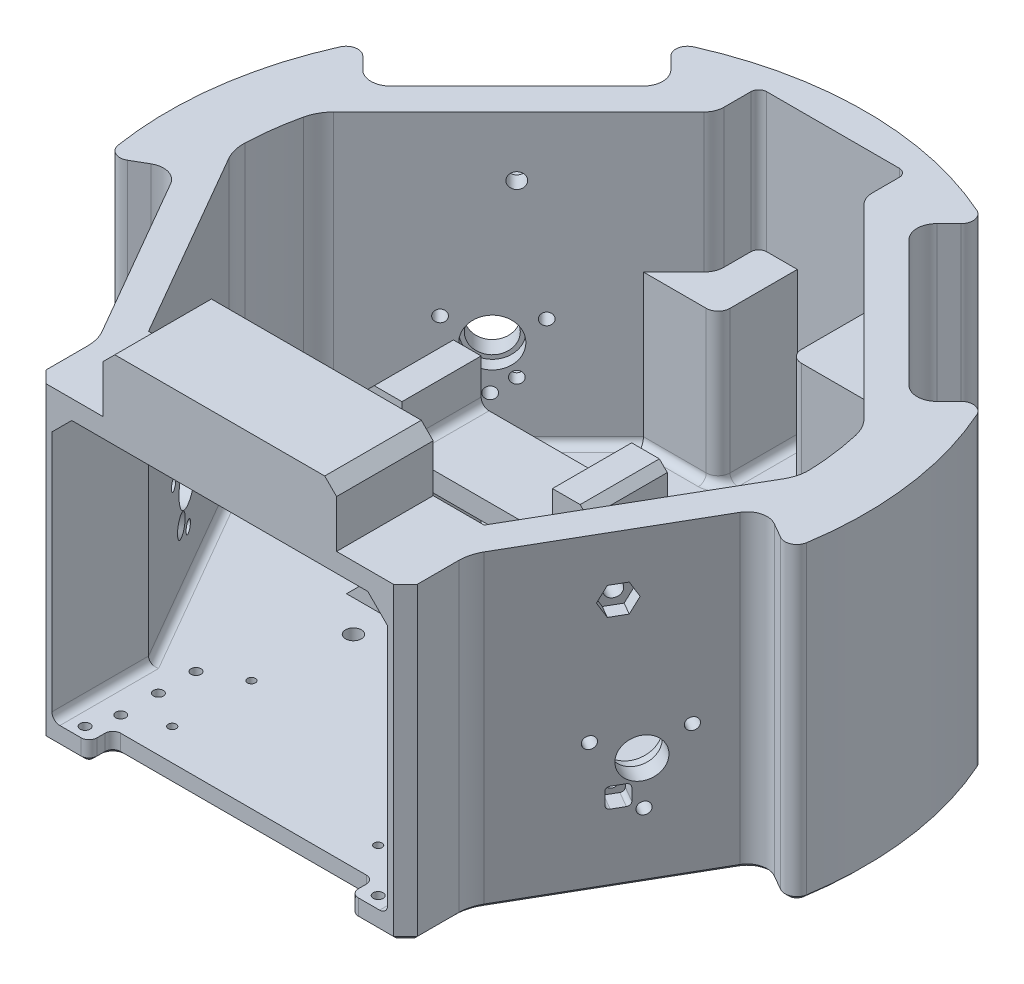
from build123d import *

# Parameters (mm, degrees)
BOSS_EXTRUDE1_DEPTH              = 5
BOSS_EXTRUDE2_DEPTH              = 73
SKETCH6_W                        = 84.74355653
SKETCH6_H                        = 24.390072762
BOSS_EXTRUDE4_DEPTH              = 4.8
FILLET1_R                        = 2
FILLET2_R                        = 5
FILLET3_R                        = 10
FILLET4_R                        = 3
CHAMFER1_SIZE                    = 5
SKETCH7_W                        = 5
SKETCH7_H                        = 5
CUT_EXTRUDE1_DEPTH               = 4.5
SKETCH10_R                       = 1
CUT_EXTRUDE2_DEPTH               = 2
HOLE1_START                      = 62
HOLE1_OUTLINE_R                  = 5
HOLE1_DEPTH                      = 8
HOLE1_2_OUTLINE_R                = 6
HOLE1_2_OUTLINE_R_2              = 5
HOLE1_2_DEPTH                    = 3.3
FILLET5_R                        = 1
F_3_0_START                      = 62
F_3_0_3_DIAMETER_HOLE1_OUTLINE_R = 1.5
F_3_0_3_DIAMETER_HOLE1_DEPTH     = 8
MIRROR2_START                    = -70
MIRROR2_OUTLINE_R                = 5
MIRROR2_OUTLINE_R_2              = 1.5
MIRROR2_DEPTH                    = 8
MIRROR2_START_2                  = -65.3
MIRROR2_2_OUTLINE_R              = 6
MIRROR2_2_OUTLINE_R_2            = 5
MIRROR2_2_DEPTH                  = 3.3
FILLET5_OF_MIRROR3_R             = 1
SKETCH19_W                       = 5
SKETCH19_H                       = 5
CUT_EXTRUDE3_DEPTH               = 4.5
SKETCH20_R                       = 1.5
CUT_EXTRUDE4_DEPTH               = 3.5
FILLET6_R                        = 1
HOLE2_START                      = -70
HOLE2_OUTLINE_R                  = 5
HOLE2_DEPTH                      = 8
HOLE2_START_2                    = -65.3
HOLE2_2_OUTLINE_R                = 6
HOLE2_2_OUTLINE_R_2              = 5
HOLE2_2_DEPTH                    = 3.3
F_3_0_3_DIAMETER_HOLE2_REACH     = 203.219
F_3_0_3_DIAMETER_HOLE2_BORE_R    = 1.5
FILLET6_OF_MIRROR8_R             = 1
SKETCH28_R                       = 1.5
CUT_EXTRUDE5_DEPTH               = 3.5
F_3_0_3_DIAMETER_HOLE3_REACH     = 203.219
F_3_0_3_DIAMETER_HOLE3_BORE_R    = 1.5
F_2_5MM_DOWEL_HOLE2_REACH        = 148.874
F_2_5MM_DOWEL_HOLE2_BORE_R       = 1.25
F_4_0_4_DIAMETER_HOLE1_D         = 4
F_2_0MM_DOWEL_HOLE1_REACH        = 148.874
F_2_0MM_DOWEL_HOLE1_BORE_R       = 1
FILLET9_R                        = 2
BOSS_EXTRUDE5_START              = 38
BOSS_EXTRUDE5_DEPTH              = 38
FILLET10_R                       = 3
SKETCH42_W                       = 9
SKETCH42_H                       = 20
BOSS_EXTRUDE6_DEPTH              = 33
SKETCH43_W                       = 56
SKETCH43_H                       = 20
BOSS_EXTRUDE7_DEPTH              = 5
SKETCH44_W                       = 9
SKETCH44_H                       = 20
BOSS_EXTRUDE8_DEPTH              = 11
FILLET11_R                       = 2
CHAMFER2_SIZE                    = 5
CHAMFER3_SIZE                    = 2
CUT_EXTRUDE6_DEPTH               = 3.5
M3_5_START                       = -66.5
M3_5_CLEARANCE_HOLE1_OUTLINE_R   = 1.95
M3_5_CLEARANCE_HOLE1_DEPTH       = 4.5
CUT_EXTRUDE7_DEPTH               = 3.5
M3_5_CLEARANCE_HOLE2_OUTLINE_R   = 1.95
M3_5_CLEARANCE_HOLE2_DEPTH       = 4.5
CHAMFER4_SIZE                    = 1
FILLET12_R                       = 2
SKETCH51_W                       = 59
SKETCH51_H                       = 24.390072762
BOSS_EXTRUDE9_DEPTH              = 15
CHAMFER5_SIZE                    = 3


# Read off the part's stored shape, not the designer's step: Hole1, Ø3.0 (3) Diameter Hole1, Mirror2, Hole2, M3.5 Clearance Hole1, M3.5 Clearance Hole2
with BuildPart() as part:
    # Sketch2 → Boss-Extrude1 (new body)
    with BuildSketch(Plane(origin=(0, 0, 0), x_dir=(1, 0, 0), z_dir=(0, 1, 0))):
        with BuildLine():
            Line((30.0520382, 68.942911166), (68.942911166, 30.0520382))
            Line((68.942911166, 30.0520382), (78.554445948, 39.663572983))
            ThreePointArc((78.554445948, 39.663572983), (87.247147801, 11.486304915), (86.143456196, -17.980682818))
            Line((86.143456196, -17.980682818), (74.371778265, -11.184301396))
            Line((74.371778265, -11.184301396), (46.871778265, -58.815698604))
            Line((46.871778265, -58.815698604), (46.871778265, -72))
            Line((46.871778265, -72), (43.871778265, -75))
            Line((43.871778265, -75), (33, -75))
            Line((33, -75), (33, -69))
            Line((33, -69), (-33, -69))
            Line((-33, -69), (-33, -75))
            Line((-33, -75), (-43.871778265, -75))
            Line((-43.871778265, -75), (-46.871778265, -72))
            Line((-46.871778265, -72), (-46.871778265, -58.815698604))
            Line((-46.871778265, -58.815698604), (-74.371778265, -11.184301396))
            Line((-74.371778265, -11.184301396), (-86.143456196, -17.980682818))
            ThreePointArc((-86.143456196, -17.980682818), (-87.247147801, 11.486304915), (-78.554445948, 39.663572983))
            Line((-78.554445948, 39.663572983), (-68.942911166, 30.0520382))
            Line((-68.942911166, 30.0520382), (-30.0520382, 68.942911166))
            Line((-30.0520382, 68.942911166), (-39.663572983, 78.554445948))
            ThreePointArc((-39.663572983, 78.554445948), (0, 88), (39.663572983, 78.554445948))
            Line((39.663572983, 78.554445948), (30.0520382, 68.942911166))
        make_face()
    extrude(amount=BOSS_EXTRUDE1_DEPTH)

    # Sketch4 → Boss-Extrude2 (add)
    with BuildSketch(Plane(origin=(0, 5, 0), x_dir=(1, 0, 0), z_dir=(0, 1, 0))):
        with BuildLine():
            Line((-68.942911166, 18.738329701), (-18.738329701, 68.942911166))
            Line((-18.738329701, 68.942911166), (-18.738329701, 79.830288738))
            Line((-18.738329701, 79.830288738), (18.738329701, 79.830288738))
            Line((18.738329701, 79.830288738), (18.738329701, 68.942911166))
            Line((18.738329701, 68.942911166), (68.942911166, 18.738329701))
            ThreePointArc((68.942911166, 18.738329701), (70.832820425, 9.32531772), (71.443575035, -0.256098166))
            Line((71.443575035, -0.256098166), (42.371778265, -50.609927238))
            Line((42.371778265, -50.609927238), (42.371778265, -75))
            Line((42.371778265, -75), (43.871778265, -75))
            Line((43.871778265, -75), (46.871778265, -72))
            Line((46.871778265, -72), (46.871778265, -58.815698604))
            Line((46.871778265, -58.815698604), (74.371778265, -11.184301396))
            Line((74.371778265, -11.184301396), (86.143456196, -17.980682818))
            ThreePointArc((86.143456196, -17.980682818), (87.247147801, 11.486304915), (78.554445948, 39.663572983))
            Line((78.554445948, 39.663572983), (68.942911166, 30.0520382))
            Line((68.942911166, 30.0520382), (30.0520382, 68.942911166))
            Line((30.0520382, 68.942911166), (39.663572983, 78.554445948))
            ThreePointArc((39.663572983, 78.554445948), (0, 88), (-39.663572983, 78.554445948))
            Line((-39.663572983, 78.554445948), (-30.0520382, 68.942911166))
            Line((-30.0520382, 68.942911166), (-68.942911166, 30.0520382))
            Line((-68.942911166, 30.0520382), (-78.554445948, 39.663572983))
            ThreePointArc((-78.554445948, 39.663572983), (-87.247147801, 11.486304915), (-86.143456196, -17.980682818))
            Line((-86.143456196, -17.980682818), (-74.371778265, -11.184301396))
            Line((-74.371778265, -11.184301396), (-46.871778265, -58.815698604))
            Line((-46.871778265, -58.815698604), (-46.871778265, -72))
            Line((-46.871778265, -72), (-43.871778265, -75))
            Line((-43.871778265, -75), (-42.371778265, -75))
            Line((-42.371778265, -75), (-42.371778265, -50.609927238))
            Line((-42.371778265, -50.609927238), (-71.443575035, -0.256098166))
            ThreePointArc((-71.443575035, -0.256098166), (-70.832820425, 9.32531772), (-68.942911166, 18.738329701))
        make_face()
    extrude(amount=BOSS_EXTRUDE2_DEPTH)

    # Sketch6 → Boss-Extrude4 (add)
    with BuildSketch(Plane(origin=(0, 78, 0), x_dir=(1, 0, 0), z_dir=(0, 1, 0))):
        with Locations((0, -62.804963619)):
            Rectangle(SKETCH6_W, SKETCH6_H)
    extrude(amount=-BOSS_EXTRUDE4_DEPTH)

    # Fillet1
    fillet1_edges = [part.edges().sort_by_distance(p)[0] for p in [
        (33, 2.5, 75),
        (33, 2.5, 69),
        (-33, 2.5, 69),
        (-33, 2.5, 75),
    ]]
    fillet(fillet1_edges, radius=FILLET1_R)

    # Fillet2
    fillet2_edges = [part.edges().sort_by_distance(p)[0] for p in [
        (30.0520382, 39, -68.942911166),
        (68.942911166, 39, -30.0520382),
        (74.371778265, 39, 11.184301396),
        (-74.371778265, 39, 11.184301396),
        (-68.942911166, 39, -30.0520382),
        (-30.0520382, 39, -68.942911166),
        (18.738329701, 41.5, -68.942911166),
        (-18.738329701, 41.5, -68.942911166),
    ]]
    fillet(fillet2_edges, radius=FILLET2_R)

    # Fillet3
    fillet3_edges = [part.edges().sort_by_distance(p)[0] for p in [
        (46.871778265, 39, 58.815698604),
        (-46.871778265, 39, 58.815698604),
        (68.942911166, 41.5, -18.738329701),
        (71.443575035, 41.5, 0.256098166),
        (-71.443575035, 41.5, 0.256098166),
        (-68.942911166, 41.5, -18.738329701),
    ]]
    fillet(fillet3_edges, radius=FILLET3_R)

    # Fillet4
    fillet4_edges = [part.edges().sort_by_distance(p)[0] for p in [
        (39.663572983, 39, -78.554445948),
        (78.554445948, 39, -39.663572983),
        (86.143456196, 39, 17.980682818),
        (-86.143456196, 39, 17.980682818),
        (-78.554445948, 39, -39.663572983),
        (-39.663572983, 39, -78.554445948),
    ]]
    fillet(fillet4_edges, radius=FILLET4_R)

    # Chamfer1
    chamfer1_edges = [part.edges().sort_by_distance(p)[0] for p in [
        (-42.371778265, 73.2, 62.804963619),
        (42.371778265, 73.2, 62.804963619),
    ]]
    chamfer(chamfer1_edges, length=CHAMFER1_SIZE)

    # Sketch7 → Cut-Extrude1 (cut)
    with BuildSketch(Plane(origin=(60.621778265, 0, 35), x_dir=(0.49999999999999983, 0, -0.8660254037844387), z_dir=(0.8660254037844387, 0, 0.49999999999999983))):
        with Locations((0, 20)):
            Rectangle(SKETCH7_W, SKETCH7_H)
    cut_extrude1 = extrude(amount=-CUT_EXTRUDE1_DEPTH, mode=Mode.SUBTRACT)

    # Sketch10 → Cut-Extrude2 (cut)
    with BuildSketch(Plane(origin=(56.724663948, 0, 32.75), x_dir=(0.4999999999999997, 0, -0.8660254037844388), z_dir=(0.8660254037844389, 0, 0.49999999999999983))):
        with Locations((0, 20)):
            Circle(SKETCH10_R)
    cut_extrude2 = extrude(amount=-CUT_EXTRUDE2_DEPTH, mode=Mode.SUBTRACT)

    # Sketch9 → CSK for M3 SFHCS1 (revolve, cut)
    with BuildSketch(Plane(origin=(53.693575035, 20, 31), x_dir=(-0.5000000000000001, 0, 0.8660254037844386), z_dir=(0, 1, 0))):
        Polygon((0, 0), (0, 8.750075774), (1.25, 7.999), (1.25, 1.4), (2.65, 0), align=None)
    revolve(axis=Axis((48.194313721, 20, 27.825), (0.8660254037844387, 0, 0.5000000000000001)), mode=Mode.SUBTRACT)

    # Hole1 outline → Hole1 (cut)
    with BuildSketch(Plane(origin=(0, 0, 0), x_dir=(0.5000000000000003, 0, -0.8660254037844385), z_dir=(0.8660254037844385, 0, 0.5000000000000003)).offset(HOLE1_START)):
        with Locations((4.375, 27.577722283)):
            Circle(HOLE1_OUTLINE_R)
    extrude(amount=HOLE1_DEPTH, mode=Mode.SUBTRACT)

    # Hole1 2 outline → Hole1 2 (cut)
    with BuildSketch(Plane(origin=(0, 0, 0), x_dir=(0.5000000000000003, 0, -0.8660254037844385), z_dir=(0.8660254037844385, 0, 0.5000000000000003)).offset(HOLE1_START)):
        with Locations((4.375, 27.577722283)):
            Circle(HOLE1_2_OUTLINE_R)
        with Locations((4.375, 27.577722283)):
            Circle(HOLE1_2_OUTLINE_R_2, mode=Mode.SUBTRACT)
    extrude(amount=HOLE1_2_DEPTH, mode=Mode.SUBTRACT)

    # Fillet5
    fillet5_edges = [part.edges().sort_by_distance(p)[0] for p in [
        (59.923221106, 22.5, 31.709936491),
        (59.923221106, 17.5, 31.709936491),
        (57.423221106, 17.5, 36.040063509),
        (57.423221106, 22.5, 36.040063509),
    ]]
    fillet(fillet5_edges, radius=FILLET5_R)

    # Ø3.0 (3) Diameter Hole1 outline → Ø3.0 (3) Diameter Hole1 (cut)
    with BuildSketch(Plane(origin=(0, 0, 0), x_dir=(0.49999999999999956, 0, -0.8660254037844389), z_dir=(0.8660254037844388, 0, 0.4999999999999999)).offset(F_3_0_START)):
        with Locations((4.758894464, 16.584423186)):
            Circle(F_3_0_3_DIAMETER_HOLE1_OUTLINE_R)
        with Locations((-5.337423521, 32.741909474)):
            Circle(F_3_0_3_DIAMETER_HOLE1_OUTLINE_R)
        with Locations((13.703529058, 33.40683419)):
            Circle(F_3_0_3_DIAMETER_HOLE1_OUTLINE_R)
    extrude(amount=F_3_0_3_DIAMETER_HOLE1_DEPTH, mode=Mode.SUBTRACT)

    # Mirror2 outline → Mirror2 (cut)
    with BuildSketch(Plane(origin=(0, 0, 0), x_dir=(0.5000000000000003, 0, 0.8660254037844385), z_dir=(0.8660254037844385, 0, -0.5000000000000003)).offset(MIRROR2_START)):
        with Locations((-4.375, -27.577722283)):
            Circle(MIRROR2_OUTLINE_R)
        with Locations((-13.703529058, -33.40683419)):
            Circle(MIRROR2_OUTLINE_R_2)
        with Locations((-4.758894464, -16.584423186)):
            Circle(MIRROR2_OUTLINE_R_2)
        with Locations((5.337423521, -32.741909474)):
            Circle(MIRROR2_OUTLINE_R_2)
    extrude(amount=MIRROR2_DEPTH, mode=Mode.SUBTRACT)

    # Mirror2 2 outline → Mirror2 2 (cut)
    with BuildSketch(Plane(origin=(0, 0, 0), x_dir=(0.5000000000000003, 0, 0.8660254037844385), z_dir=(0.8660254037844385, 0, -0.5000000000000003)).offset(MIRROR2_START_2)):
        with Locations((-4.375, -27.577722283)):
            Circle(MIRROR2_2_OUTLINE_R)
        with Locations((-4.375, -27.577722283)):
            Circle(MIRROR2_2_OUTLINE_R_2, mode=Mode.SUBTRACT)
    extrude(amount=MIRROR2_2_DEPTH, mode=Mode.SUBTRACT)

    # Mirror2 3 outline → Mirror2 3 (revolve, cut)
    with BuildSketch(Plane(origin=(0, 20, 0), x_dir=(0.5000000000000003, 0, 0.8660254037844385), z_dir=(0, 1, 0))):
        Polygon((0, -62), (0, -65.5), (1.25, -65.5), (1.25, -63.4), (2.65, -62), align=None)
    revolve(axis=Axis((0, 20, 0), (0.8660254037844385, 0, -0.5000000000000003)), mode=Mode.SUBTRACT)

    # Mirror3: Cut-Extrude1, Cut-Extrude2 across plane
    add(cut_extrude1.mirror(Plane(origin=(0, 0, 0), x_dir=(0, 0, 1), z_dir=(1, 0, 0))), mode=Mode.SUBTRACT)
    add(cut_extrude2.mirror(Plane(origin=(0, 0, 0), x_dir=(0, 0, 1), z_dir=(1, 0, 0))), mode=Mode.SUBTRACT)

    # Fillet5 of Mirror3
    fillet5_of_mirror3_edges = [part.edges().sort_by_distance(p)[0] for p in [
        (-59.923221106, 22.5, 31.709936491),
        (-59.923221106, 17.5, 31.709936491),
        (-57.423221106, 17.5, 36.040063509),
        (-57.423221106, 22.5, 36.040063509),
    ]]
    fillet(fillet5_of_mirror3_edges, radius=FILLET5_OF_MIRROR3_R)

    # Sketch19 → Cut-Extrude3 (cut)
    with BuildSketch(Plane(origin=(-49.497474683, 0, -49.497474683), x_dir=(-0.7071067811865475, 0, 0.7071067811865477), z_dir=(-0.7071067811865477, 0, -0.7071067811865475))):
        with Locations((0, 20)):
            Rectangle(SKETCH19_W, SKETCH19_H)
    cut_extrude3 = extrude(amount=-CUT_EXTRUDE3_DEPTH, mode=Mode.SUBTRACT)

    # Sketch20 → Cut-Extrude4 (cut)
    with BuildSketch(Plane(origin=(-46.315494168, 0, -46.315494168), x_dir=(-0.7071067811865475, 0, 0.7071067811865477), z_dir=(-0.7071067811865477, 0, -0.7071067811865475))):
        with Locations((0, 20)):
            Circle(SKETCH20_R)
    extrude(amount=-CUT_EXTRUDE4_DEPTH, mode=Mode.SUBTRACT)

    # Fillet6
    fillet6_edges = [part.edges().sort_by_distance(p)[0] for p in [
        (-49.674251378, 22.5, -46.138717472),
        (-49.674251378, 17.5, -46.138717472),
        (-46.138717472, 17.5, -49.674251378),
        (-46.138717472, 22.5, -49.674251378),
    ]]
    fillet(fillet6_edges, radius=FILLET6_R)

    # Hole2 outline → Hole2 (cut)
    with BuildSketch(Plane(origin=(0, 0, 0), x_dir=(0.7071067811865471, 0, -0.707106781186548), z_dir=(0.707106781186548, 0, 0.707106781186547)).offset(HOLE2_START)):
        with Locations((-4.375, 27.577722283)):
            Circle(HOLE2_OUTLINE_R)
    hole2 = extrude(amount=HOLE2_DEPTH, mode=Mode.SUBTRACT)

    # Hole2 2 outline → Hole2 2 (cut)
    with BuildSketch(Plane(origin=(0, 0, 0), x_dir=(0.7071067811865471, 0, -0.707106781186548), z_dir=(0.707106781186548, 0, 0.707106781186547)).offset(HOLE2_START_2)):
        with Locations((-4.375, 27.577722283)):
            Circle(HOLE2_2_OUTLINE_R)
        with Locations((-4.375, 27.577722283)):
            Circle(HOLE2_2_OUTLINE_R_2, mode=Mode.SUBTRACT)
    hole2_2 = extrude(amount=HOLE2_2_DEPTH, mode=Mode.SUBTRACT)

    # Ø3.0 (3) Diameter Hole2 bore → Ø3.0 (3) Diameter Hole2 (cut, up to next)
    with BuildSketch(Plane(origin=(-49.497474683, 0, -49.497474683), x_dir=(-0.7071067811865475, 0, 0.7071067811865477), z_dir=(-0.7071067811865477, 0, -0.7071067811865475)), mode=Mode.PRIVATE) as f_3_0_3_diameter_hole2_sk1:
        with Locations((13.703529058, 33.40683419)):
            Circle(F_3_0_3_DIAMETER_HOLE2_BORE_R)
    f_3_0_3_diameter_hole2_tool1 = extrude(f_3_0_3_diameter_hole2_sk1.sketch, amount=-F_3_0_3_DIAMETER_HOLE2_REACH, mode=Mode.PRIVATE) & part.part
    # Ø3.0 (3) Diameter Hole2 bore → Ø3.0 (3) Diameter Hole2 (cut, up to next)
    with BuildSketch(Plane(origin=(-49.497474683, 0, -49.497474683), x_dir=(-0.7071067811865475, 0, 0.7071067811865477), z_dir=(-0.7071067811865477, 0, -0.7071067811865475)), mode=Mode.PRIVATE) as f_3_0_3_diameter_hole2_sk2:
        with Locations((-5.337423521, 32.741909474)):
            Circle(F_3_0_3_DIAMETER_HOLE2_BORE_R)
    f_3_0_3_diameter_hole2_tool2 = extrude(f_3_0_3_diameter_hole2_sk2.sketch, amount=-F_3_0_3_DIAMETER_HOLE2_REACH, mode=Mode.PRIVATE) & part.part
    # Ø3.0 (3) Diameter Hole2 bore → Ø3.0 (3) Diameter Hole2 (cut, up to next)
    with BuildSketch(Plane(origin=(-49.497474683, 0, -49.497474683), x_dir=(-0.7071067811865475, 0, 0.7071067811865477), z_dir=(-0.7071067811865477, 0, -0.7071067811865475)), mode=Mode.PRIVATE) as f_3_0_3_diameter_hole2_sk3:
        with Locations((4.758894464, 16.584423186)):
            Circle(F_3_0_3_DIAMETER_HOLE2_BORE_R)
    f_3_0_3_diameter_hole2_tool3 = extrude(f_3_0_3_diameter_hole2_sk3.sketch, amount=-F_3_0_3_DIAMETER_HOLE2_REACH, mode=Mode.PRIVATE) & part.part
    add(f_3_0_3_diameter_hole2_tool1.solids().sort_by_distance((-59.187333, 33.406834, -39.807616))[0], mode=Mode.SUBTRACT)
    add(f_3_0_3_diameter_hole2_tool2.solids().sort_by_distance((-45.723346, 32.741909, -53.271603))[0], mode=Mode.SUBTRACT)
    add(f_3_0_3_diameter_hole2_tool3.solids().sort_by_distance((-52.862521, 16.584423, -46.132428))[0], mode=Mode.SUBTRACT)

    # Mirror6: Hole2, Hole2 2 across plane
    add(hole2.mirror(Plane(origin=(0, 0, 0), x_dir=(0, 0, 1), z_dir=(1, 0, 0))), mode=Mode.SUBTRACT)
    add(hole2_2.mirror(Plane(origin=(0, 0, 0), x_dir=(0, 0, 1), z_dir=(1, 0, 0))), mode=Mode.SUBTRACT)

    # Mirror8: Cut-Extrude3 across plane
    add(cut_extrude3.mirror(Plane(origin=(0, 0, 0), x_dir=(0, 0, 1), z_dir=(1, 0, 0))), mode=Mode.SUBTRACT)

    # Fillet6 of Mirror8
    fillet6_of_mirror8_edges = [part.edges().sort_by_distance(p)[0] for p in [
        (49.674251378, 22.5, -46.138717472),
        (49.674251378, 17.5, -46.138717472),
        (46.138717472, 17.5, -49.674251378),
        (46.138717472, 22.5, -49.674251378),
    ]]
    fillet(fillet6_of_mirror8_edges, radius=FILLET6_OF_MIRROR8_R)

    # Sketch28 → Cut-Extrude5 (cut)
    with BuildSketch(Plane(origin=(46.315494168, 0, -46.315494168), x_dir=(-0.7071067811865475, 0, -0.7071067811865477), z_dir=(0.7071067811865477, 0, -0.7071067811865475))):
        with Locations((0, 20)):
            Circle(SKETCH28_R)
    extrude(amount=-CUT_EXTRUDE5_DEPTH, mode=Mode.SUBTRACT)

    # Ø3.0 (3) Diameter Hole3 bore → Ø3.0 (3) Diameter Hole3 (cut, up to next)
    with BuildSketch(Plane(origin=(49.497474683, 0, -49.497474683), x_dir=(-0.7071067811865476, 0, -0.7071067811865476), z_dir=(0.7071067811865476, 0, -0.7071067811865476)), mode=Mode.PRIVATE) as f_3_0_3_diameter_hole3_sk1:
        with Locations((1.9343408, 36.58839477)):
            Circle(F_3_0_3_DIAMETER_HOLE3_BORE_R)
    f_3_0_3_diameter_hole3_tool1 = extrude(f_3_0_3_diameter_hole3_sk1.sketch, amount=-F_3_0_3_DIAMETER_HOLE3_REACH, mode=Mode.PRIVATE) & part.part
    # Ø3.0 (3) Diameter Hole3 bore → Ø3.0 (3) Diameter Hole3 (cut, up to next)
    with BuildSketch(Plane(origin=(49.497474683, 0, -49.497474683), x_dir=(-0.7071067811865476, 0, -0.7071067811865476), z_dir=(0.7071067811865476, 0, -0.7071067811865476)), mode=Mode.PRIVATE) as f_3_0_3_diameter_hole3_sk2:
        with Locations((-15.333141679, 28.536435453)):
            Circle(F_3_0_3_DIAMETER_HOLE3_BORE_R)
    f_3_0_3_diameter_hole3_tool2 = extrude(f_3_0_3_diameter_hole3_sk2.sketch, amount=-F_3_0_3_DIAMETER_HOLE3_REACH, mode=Mode.PRIVATE) & part.part
    add(f_3_0_3_diameter_hole3_tool1.solids().sort_by_distance((48.129689, 36.588395, -50.86526))[0], mode=Mode.SUBTRACT)
    add(f_3_0_3_diameter_hole3_tool2.solids().sort_by_distance((60.339643, 28.536435, -38.655306))[0], mode=Mode.SUBTRACT)

    # Ø2.5mm Dowel Hole2 bore → Ø2.5mm Dowel Hole2 (cut, up to next)
    with BuildSketch(Plane(origin=(0, 0, 0), x_dir=(-1, 0, 0), z_dir=(0, -1, 0)), mode=Mode.PRIVATE) as f_2_5mm_dowel_hole2_sk1:
        with Locations((35, -65)):
            Circle(F_2_5MM_DOWEL_HOLE2_BORE_R)
    f_2_5mm_dowel_hole2_tool1 = extrude(f_2_5mm_dowel_hole2_sk1.sketch, amount=-F_2_5MM_DOWEL_HOLE2_REACH, mode=Mode.PRIVATE) & part.part
    # Ø2.5mm Dowel Hole2 bore → Ø2.5mm Dowel Hole2 (cut, up to next)
    with BuildSketch(Plane(origin=(0, 0, 0), x_dir=(-1, 0, 0), z_dir=(0, -1, 0)), mode=Mode.PRIVATE) as f_2_5mm_dowel_hole2_sk2:
        with Locations((35, -46)):
            Circle(F_2_5MM_DOWEL_HOLE2_BORE_R)
    f_2_5mm_dowel_hole2_tool2 = extrude(f_2_5mm_dowel_hole2_sk2.sketch, amount=-F_2_5MM_DOWEL_HOLE2_REACH, mode=Mode.PRIVATE) & part.part
    # Ø2.5mm Dowel Hole2 bore → Ø2.5mm Dowel Hole2 (cut, up to next)
    with BuildSketch(Plane(origin=(0, 0, 0), x_dir=(-1, 0, 0), z_dir=(0, -1, 0)), mode=Mode.PRIVATE) as f_2_5mm_dowel_hole2_sk3:
        with Locations((-35, -65)):
            Circle(F_2_5MM_DOWEL_HOLE2_BORE_R)
    f_2_5mm_dowel_hole2_tool3 = extrude(f_2_5mm_dowel_hole2_sk3.sketch, amount=-F_2_5MM_DOWEL_HOLE2_REACH, mode=Mode.PRIVATE) & part.part
    # Ø2.5mm Dowel Hole2 bore → Ø2.5mm Dowel Hole2 (cut, up to next)
    with BuildSketch(Plane(origin=(0, 0, 0), x_dir=(-1, 0, 0), z_dir=(0, -1, 0)), mode=Mode.PRIVATE) as f_2_5mm_dowel_hole2_sk4:
        with Locations((-35, -46)):
            Circle(F_2_5MM_DOWEL_HOLE2_BORE_R)
    f_2_5mm_dowel_hole2_tool4 = extrude(f_2_5mm_dowel_hole2_sk4.sketch, amount=-F_2_5MM_DOWEL_HOLE2_REACH, mode=Mode.PRIVATE) & part.part
    # Ø2.5mm Dowel Hole2 bore → Ø2.5mm Dowel Hole2 (cut, up to next)
    with BuildSketch(Plane(origin=(0, 0, 0), x_dir=(-1, 0, 0), z_dir=(0, -1, 0)), mode=Mode.PRIVATE) as f_2_5mm_dowel_hole2_sk5:
        with Locations((-37, -72)):
            Circle(F_2_5MM_DOWEL_HOLE2_BORE_R)
    f_2_5mm_dowel_hole2_tool5 = extrude(f_2_5mm_dowel_hole2_sk5.sketch, amount=-F_2_5MM_DOWEL_HOLE2_REACH, mode=Mode.PRIVATE) & part.part
    # Ø2.5mm Dowel Hole2 bore → Ø2.5mm Dowel Hole2 (cut, up to next)
    with BuildSketch(Plane(origin=(0, 0, 0), x_dir=(-1, 0, 0), z_dir=(0, -1, 0)), mode=Mode.PRIVATE) as f_2_5mm_dowel_hole2_sk6:
        with Locations((37, -72)):
            Circle(F_2_5MM_DOWEL_HOLE2_BORE_R)
    f_2_5mm_dowel_hole2_tool6 = extrude(f_2_5mm_dowel_hole2_sk6.sketch, amount=-F_2_5MM_DOWEL_HOLE2_REACH, mode=Mode.PRIVATE) & part.part
    # Ø2.5mm Dowel Hole2 bore → Ø2.5mm Dowel Hole2 (cut, up to next)
    with BuildSketch(Plane(origin=(0, 0, 0), x_dir=(-1, 0, 0), z_dir=(0, -1, 0)), mode=Mode.PRIVATE) as f_2_5mm_dowel_hole2_sk7:
        with Locations((35, -55.5)):
            Circle(F_2_5MM_DOWEL_HOLE2_BORE_R)
    f_2_5mm_dowel_hole2_tool7 = extrude(f_2_5mm_dowel_hole2_sk7.sketch, amount=-F_2_5MM_DOWEL_HOLE2_REACH, mode=Mode.PRIVATE) & part.part
    # Ø2.5mm Dowel Hole2 bore → Ø2.5mm Dowel Hole2 (cut, up to next)
    with BuildSketch(Plane(origin=(0, 0, 0), x_dir=(-1, 0, 0), z_dir=(0, -1, 0)), mode=Mode.PRIVATE) as f_2_5mm_dowel_hole2_sk8:
        with Locations((-35, -55.5)):
            Circle(F_2_5MM_DOWEL_HOLE2_BORE_R)
    f_2_5mm_dowel_hole2_tool8 = extrude(f_2_5mm_dowel_hole2_sk8.sketch, amount=-F_2_5MM_DOWEL_HOLE2_REACH, mode=Mode.PRIVATE) & part.part
    add(f_2_5mm_dowel_hole2_tool1.solids().sort_by_distance((-35, 0, 65))[0], mode=Mode.SUBTRACT)
    add(f_2_5mm_dowel_hole2_tool2.solids().sort_by_distance((-35, 0, 46))[0], mode=Mode.SUBTRACT)
    add(f_2_5mm_dowel_hole2_tool3.solids().sort_by_distance((35, 0, 65))[0], mode=Mode.SUBTRACT)
    add(f_2_5mm_dowel_hole2_tool4.solids().sort_by_distance((35, 0, 46))[0], mode=Mode.SUBTRACT)
    add(f_2_5mm_dowel_hole2_tool5.solids().sort_by_distance((37, 0, 72))[0], mode=Mode.SUBTRACT)
    add(f_2_5mm_dowel_hole2_tool6.solids().sort_by_distance((-37, 0, 72))[0], mode=Mode.SUBTRACT)
    add(f_2_5mm_dowel_hole2_tool7.solids().sort_by_distance((-35, 0, 55.5))[0], mode=Mode.SUBTRACT)
    add(f_2_5mm_dowel_hole2_tool8.solids().sort_by_distance((35, 0, 55.5))[0], mode=Mode.SUBTRACT)

    # Ø4.0 (4) Diameter Hole1 (through all)
    with Locations(Plane(origin=(0, 0, 0), x_dir=(-1, 0, 0), z_dir=(0, -1, 0))):
        with Locations((5, 38), (-5, 38), (23.25, -18), (-23.25, -18)):
            Hole(F_4_0_4_DIAMETER_HOLE1_D / 2)

    # Ø2.0mm Dowel Hole1 bore → Ø2.0mm Dowel Hole1 (cut, up to next)
    with BuildSketch(Plane(origin=(0, 0, 0), x_dir=(-1, 0, 0), z_dir=(0, -1, 0)), mode=Mode.PRIVATE) as f_2_0mm_dowel_hole1_sk1:
        with Locations((26, -61)):
            Circle(F_2_0MM_DOWEL_HOLE1_BORE_R)
    f_2_0mm_dowel_hole1_tool1 = extrude(f_2_0mm_dowel_hole1_sk1.sketch, amount=-F_2_0MM_DOWEL_HOLE1_REACH, mode=Mode.PRIVATE) & part.part
    # Ø2.0mm Dowel Hole1 bore → Ø2.0mm Dowel Hole1 (cut, up to next)
    with BuildSketch(Plane(origin=(0, 0, 0), x_dir=(-1, 0, 0), z_dir=(0, -1, 0)), mode=Mode.PRIVATE) as f_2_0mm_dowel_hole1_sk2:
        with Locations((26, -41)):
            Circle(F_2_0MM_DOWEL_HOLE1_BORE_R)
    f_2_0mm_dowel_hole1_tool2 = extrude(f_2_0mm_dowel_hole1_sk2.sketch, amount=-F_2_0MM_DOWEL_HOLE1_REACH, mode=Mode.PRIVATE) & part.part
    # Ø2.0mm Dowel Hole1 bore → Ø2.0mm Dowel Hole1 (cut, up to next)
    with BuildSketch(Plane(origin=(0, 0, 0), x_dir=(-1, 0, 0), z_dir=(0, -1, 0)), mode=Mode.PRIVATE) as f_2_0mm_dowel_hole1_sk3:
        with Locations((-26, -41)):
            Circle(F_2_0MM_DOWEL_HOLE1_BORE_R)
    f_2_0mm_dowel_hole1_tool3 = extrude(f_2_0mm_dowel_hole1_sk3.sketch, amount=-F_2_0MM_DOWEL_HOLE1_REACH, mode=Mode.PRIVATE) & part.part
    # Ø2.0mm Dowel Hole1 bore → Ø2.0mm Dowel Hole1 (cut, up to next)
    with BuildSketch(Plane(origin=(0, 0, 0), x_dir=(-1, 0, 0), z_dir=(0, -1, 0)), mode=Mode.PRIVATE) as f_2_0mm_dowel_hole1_sk4:
        with Locations((-26, -61)):
            Circle(F_2_0MM_DOWEL_HOLE1_BORE_R)
    f_2_0mm_dowel_hole1_tool4 = extrude(f_2_0mm_dowel_hole1_sk4.sketch, amount=-F_2_0MM_DOWEL_HOLE1_REACH, mode=Mode.PRIVATE) & part.part
    add(f_2_0mm_dowel_hole1_tool1.solids().sort_by_distance((-26, 0, 61))[0], mode=Mode.SUBTRACT)
    add(f_2_0mm_dowel_hole1_tool2.solids().sort_by_distance((-26, 0, 41))[0], mode=Mode.SUBTRACT)
    add(f_2_0mm_dowel_hole1_tool3.solids().sort_by_distance((26, 0, 41))[0], mode=Mode.SUBTRACT)
    add(f_2_0mm_dowel_hole1_tool4.solids().sort_by_distance((26, 0, 61))[0], mode=Mode.SUBTRACT)

    # Fillet9
    fillet9_edges = [part.edges().sort_by_distance(p)[0] for p in [
        (-18.738329701, 41.5, -79.830288738),
        (18.738329701, 41.5, -79.830288738),
    ]]
    fillet(fillet9_edges, radius=FILLET9_R)

    # Sketch41 → Boss-Extrude5 (add)
    with BuildSketch(Plane(origin=(0, 5, 0), x_dir=(1, 0, 0), z_dir=(0, 1, 0)).offset(BOSS_EXTRUDE5_START)):
        with BuildLine():
            Line((-16.738329701, 79.830288738), (-9, 79.830288738))
            Line((-9, 79.830288738), (-9, 59.830288738))
            Line((-9, 59.830288738), (-27.850952129, 59.830288738))
            Line((-27.850952129, 59.830288738), (-20.202795796, 67.478445072))
            ThreePointArc((-20.202795796, 67.478445072), (-19.118932039, 69.100561816), (-18.738329701, 71.013978978))
            Line((-18.738329701, 71.013978978), (-18.738329701, 77.830288738))
            ThreePointArc((-18.738329701, 77.830288738), (-18.152543264, 79.2445023), (-16.738329701, 79.830288738))
        make_face()
        with BuildLine():
            Line((18.738329701, 71.013978978), (18.738329701, 77.830288738))
            ThreePointArc((18.738329701, 77.830288738), (18.152543264, 79.2445023), (16.738329701, 79.830288738))
            Line((16.738329701, 79.830288738), (9, 79.830288738))
            Line((9, 79.830288738), (9, 59.830288738))
            Line((9, 59.830288738), (27.850952129, 59.830288738))
            Line((27.850952129, 59.830288738), (20.202795796, 67.478445072))
            ThreePointArc((20.202795796, 67.478445072), (19.118932039, 69.100561816), (18.738329701, 71.013978978))
        make_face()
    extrude(amount=-BOSS_EXTRUDE5_DEPTH)

    # Fillet10
    fillet10_edges = [part.edges().sort_by_distance(p)[0] for p in [
        (9, 24, -59.830288738),
        (-9, 24, -59.830288738),
    ]]
    fillet(fillet10_edges, radius=FILLET10_R)

    # Sketch42 → Boss-Extrude6 (add)
    with BuildSketch(Plane(origin=(0, 5, 0), x_dir=(1, 0, 0), z_dir=(0, 1, 0))):
        with Locations((23.5, 0)):
            Rectangle(SKETCH42_W, SKETCH42_H)
        with Locations((-23.5, 0)):
            Rectangle(SKETCH42_W, SKETCH42_H)
    extrude(amount=BOSS_EXTRUDE6_DEPTH)

    # Sketch43 → Boss-Extrude7 (add)
    with BuildSketch(Plane(origin=(0, 38, 0), x_dir=(1, 0, 0), z_dir=(0, 1, 0))):
        Rectangle(SKETCH43_W, SKETCH43_H)
    extrude(amount=BOSS_EXTRUDE7_DEPTH)

    # Sketch44 → Boss-Extrude8 (add)
    with BuildSketch(Plane(origin=(0, 43, 0), x_dir=(1, 0, 0), z_dir=(0, 1, 0))):
        with Locations((-23.5, 0)):
            Rectangle(SKETCH44_W, SKETCH44_H)
        with Locations((23.5, 0)):
            Rectangle(SKETCH44_W, SKETCH44_H)
    extrude(amount=BOSS_EXTRUDE8_DEPTH)

    # Fillet11
    fillet11_edges = [part.edges().sort_by_distance(p)[0] for p in [
        (19, 38, 0),
        (-19, 38, 0),
        (-19, 43, 0),
        (19, 43, 0),
    ]]
    fillet(fillet11_edges, radius=FILLET11_R)

    # Chamfer2
    chamfer2_edges = [part.edges().sort_by_distance(p)[0] for p in [
        (19, 5, 0),
        (28, 5, 0),
        (-19, 5, 0),
        (-28, 5, 0),
    ]]
    chamfer(chamfer2_edges, length=CHAMFER2_SIZE)

    # Chamfer3
    chamfer3_edges = [part.edges().sort_by_distance(p)[0] for p in [
        (-28, 54, 0),
        (28, 54, 0),
    ]]
    chamfer(chamfer3_edges, length=CHAMFER3_SIZE)

    # Sketch45 → Cut-Extrude6 (cut)
    with BuildSketch(Plane(origin=(-49.497474683, 0, -49.497474683), x_dir=(-0.7071067811865475, 0, 0.7071067811865476), z_dir=(-0.7071067811865476, 0, -0.7071067811865475))):
        Polygon((2.020725942, 66.5), (-2.020725942, 66.5), (-4.041451884, 63), (-2.020725942, 59.5), (2.020725942, 59.5), (4.041451884, 63), align=None)
    cut_extrude6 = extrude(amount=-CUT_EXTRUDE6_DEPTH, mode=Mode.SUBTRACT)

    # M3.5 Clearance Hole1 outline → M3.5 Clearance Hole1 (cut)
    with BuildSketch(Plane(origin=(0, 0, 0), x_dir=(0.7071067811865471, 0, -0.707106781186548), z_dir=(0.707106781186548, 0, 0.707106781186547)).offset(M3_5_START)):
        with Locations((0, 63)):
            Circle(M3_5_CLEARANCE_HOLE1_OUTLINE_R)
    m3_5_clearance_hole1 = extrude(amount=M3_5_CLEARANCE_HOLE1_DEPTH, mode=Mode.SUBTRACT)

    # Sketch48 → Cut-Extrude7 (cut)
    with BuildSketch(Plane(origin=(-60.621778265, 0, 35), x_dir=(0.49999999999999983, 0, 0.8660254037844387), z_dir=(-0.8660254037844387, 0, 0.49999999999999983))):
        Polygon((4.041451884, 63), (2.020725942, 66.5), (-2.020725942, 66.5), (-4.041451884, 63), (-2.020725942, 59.5), (2.020725942, 59.5), align=None)
    cut_extrude7 = extrude(amount=-CUT_EXTRUDE7_DEPTH, mode=Mode.SUBTRACT)

    # M3.5 Clearance Hole2 outline → M3.5 Clearance Hole2 (cut)
    with BuildSketch(Plane(origin=(0, 0, 0), x_dir=(0.4999999999999988, 0, 0.8660254037844395), z_dir=(0.8660254037844393, 0, -0.4999999999999991)).offset(M3_5_START)):
        with Locations((0, -63)):
            Circle(M3_5_CLEARANCE_HOLE2_OUTLINE_R)
    m3_5_clearance_hole2 = extrude(amount=M3_5_CLEARANCE_HOLE2_DEPTH, mode=Mode.SUBTRACT)

    # Mirror10: Cut-Extrude6, M3.5 Clearance Hole1, Cut-Extrude7, M3.5 Clearance Hole2 across plane
    add(cut_extrude6.mirror(Plane(origin=(0, 0, 0), x_dir=(0, 0, 1), z_dir=(1, 0, 0))), mode=Mode.SUBTRACT)
    add(m3_5_clearance_hole1.mirror(Plane(origin=(0, 0, 0), x_dir=(0, 0, 1), z_dir=(1, 0, 0))), mode=Mode.SUBTRACT)
    add(cut_extrude7.mirror(Plane(origin=(0, 0, 0), x_dir=(0, 0, 1), z_dir=(1, 0, 0))), mode=Mode.SUBTRACT)
    add(m3_5_clearance_hole2.mirror(Plane(origin=(0, 0, 0), x_dir=(0, 0, 1), z_dir=(1, 0, 0))), mode=Mode.SUBTRACT)

    # Chamfer4
    chamfer4_edges = [part.edges().sort_by_distance(p)[0] for p in [
        (0, 0, 69),
        (-33, 0, 72),
        (33, 0, 72),
        (39.435889132, 0, 75),
        (-33.585786438, 0, 74.414213562),
        (33.585786438, 0, 74.414213562),
        (-32.414213562, 0, 69.585786438),
        (32.414213562, 0, 69.585786438),
        (-60.041651246, 0, 36.004809472),
        (80.58094682, 0, 14.769166533),
        (49.497474683, 0, -49.497474683),
        (35.121803096, 0, -74.012676062),
        (-74.012676062, 0, -35.121803096),
        (-49.497474683, 0, -49.497474683),
        (-74.907810058, 0, 13.184799283),
        (46.871778265, 0, 66.747595264),
        (74.907810058, 0, 13.184799283),
        (68.942911166, 0, -32.123106012),
        (32.123106012, 0, -68.942911166),
        (-68.942911166, 0, -32.123106012),
        (45.371778265, 0, 73.5),
        (-32.123106012, 0, -68.942911166),
        (-39.435889132, 0, 75),
        (-45.371778265, 0, 73.5),
        (60.041651246, 0, 36.004809472),
        (-46.871778265, 0, 66.747595264),
        (47.212520002, 0, 58.907000077),
        (-47.212520002, 0, 58.907000077),
        (87.247147801, 0, -11.486304915),
        (-80.58094682, 0, 14.769166533),
        (-87.247147801, 0, -11.486304915),
        (-35.121803096, 0, -74.012676062),
        (0, 0, -88),
        (74.012676062, 0, -35.121803096),
        (-85.252182352, 0, 15.963396072),
        (-78.215653754, 0, -37.484344971),
        (-37.484344971, 0, -78.215653754),
        (37.484344971, 0, -78.215653754),
        (78.215653754, 0, -37.484344971),
        (85.252182352, 0, 15.963396072),
    ]]
    chamfer(chamfer4_edges, length=CHAMFER4_SIZE)

    # Fillet12
    fillet12_edges = [part.edges().sort_by_distance(p)[0] for p in [
        (-70.832820425, 5, -9.32531772),
        (56.215621257, 5, 26.631687803),
        (70.832820425, 5, -9.32531772),
        (47.418217525, 5, -40.263023342),
        (-56.215621257, 5, 26.631687803),
        (68.668582154, 5, -18.458380169),
        (71.106137287, 5, 0.056689255),
        (-68.668582154, 5, -18.458380169),
        (-71.106137287, 5, 0.056689255),
        (42.371778265, 5, 62.804963619),
        (9, 5, -71.330288738),
        (-47.418217525, 5, -40.263023342),
        (0, 5, -79.830288738),
        (-19.925476065, 5, -59.830288738),
        (19.925476065, 5, -59.830288738),
        (-9, 5, -71.330288738),
        (9.878679656, 5, -60.708968394),
        (-9.878679656, 5, -60.708968394),
        (-42.371778265, 5, 62.804963619),
    ]]
    fillet(fillet12_edges, radius=FILLET12_R)

    # Sketch51 → Boss-Extrude9 (add)
    with BuildSketch(Plane(origin=(0, 78, 0), x_dir=(1, 0, 0), z_dir=(0, 1, 0))):
        with Locations((0, -62.804963619)):
            Rectangle(SKETCH51_W, SKETCH51_H)
    extrude(amount=BOSS_EXTRUDE9_DEPTH)

    # Chamfer5
    chamfer5_edges = [part.edges().sort_by_distance(p)[0] for p in [
        (29.5, 93, 62.804963619),
        (-29.5, 93, 62.804963619),
    ]]
    chamfer(chamfer5_edges, length=CHAMFER5_SIZE)


solid = part.part
